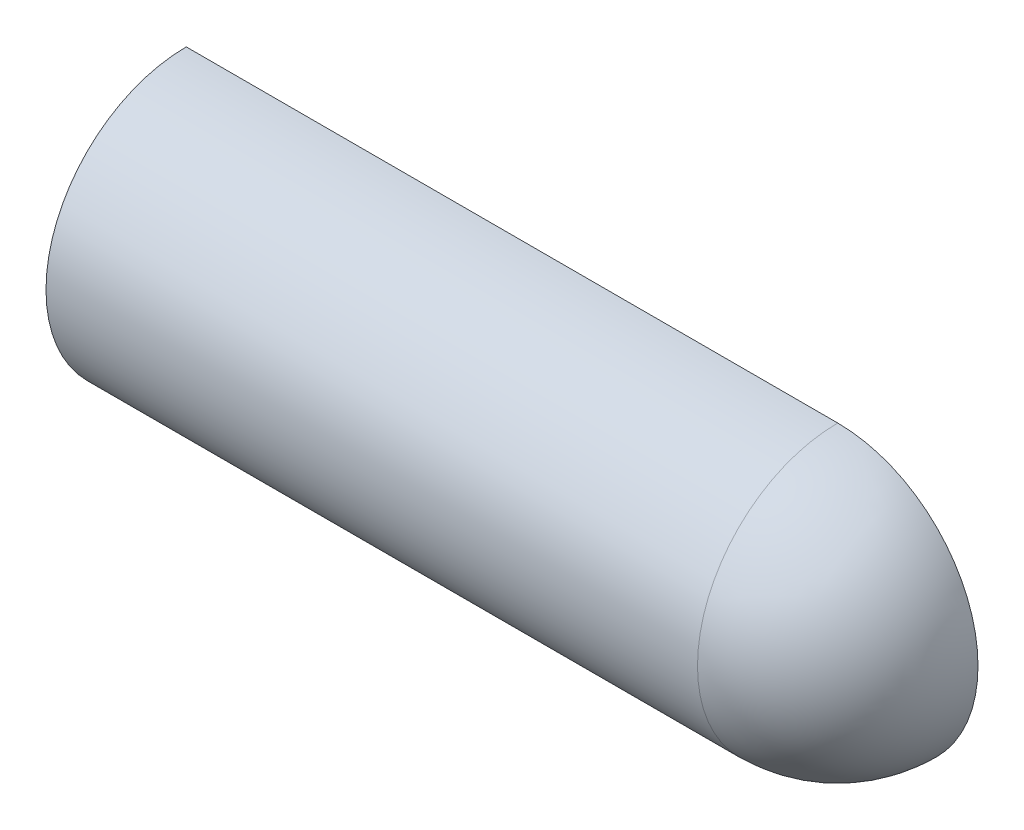
from build123d import *

# Parameters (mm, degrees)
REVOLVE1_ANGLE = 180


with BuildPart() as part:
    # Sketch2 → Revolve1 (revolve)
    with BuildSketch(Plane.XY):
        with BuildLine():
            Line((26.000000003, 0), (31.00000001, 0))
            ThreePointArc((31.00000001, 0), (21.920310226, 21.920310225), (0, 31))
            Line((0, 31), (-144, 31))
            Line((-144, 31), (-144, 26))
            Line((-144, 26), (1e-08, 26))
            ThreePointArc((1e-08, 26), (18.384776318, 18.38477631), (26.000000003, 0))
        make_face()
    revolve(axis=Axis((26.000000003, 0, 0), (1, 0, 0)), revolution_arc=REVOLVE1_ANGLE)


solid = part.part
